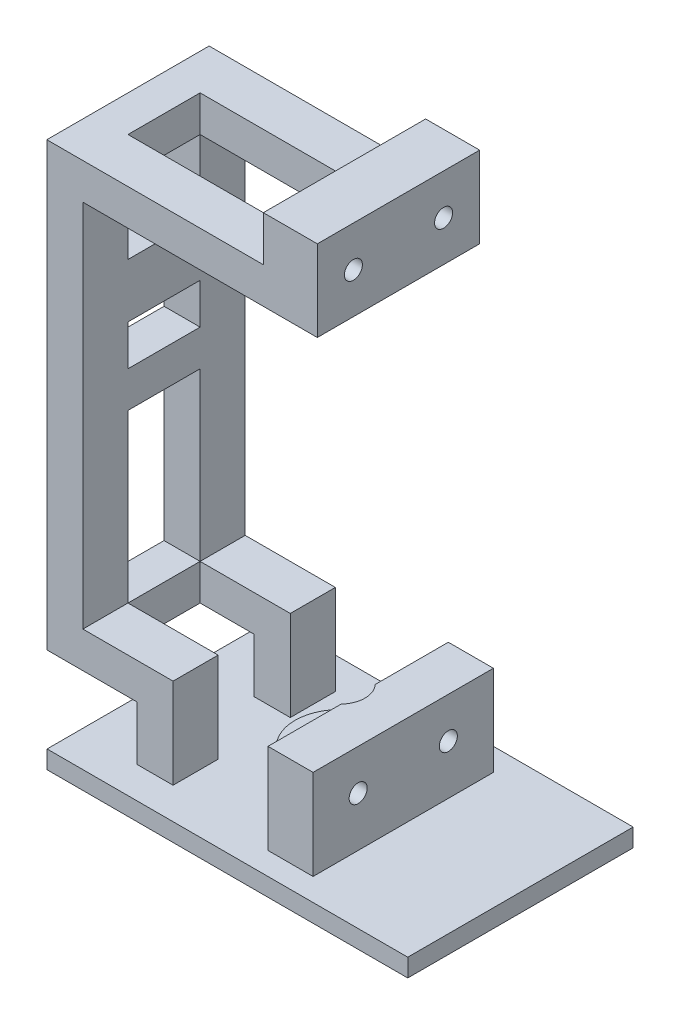
from build123d import *

# Parameters (mm, degrees)
SKETCH1_W                  = 40
SKETCH1_H                  = 25
BOSS_EXTRUDE1_DEPTH        = 2
SKETCH2_W                  = 5
SKETCH2_H                  = 20
BOSS_EXTRUDE2_DEPTH        = 10
SKETCH4_W                  = 19.965035534
SKETCH4_H                  = 6
BOSS_EXTRUDE3_DEPTH        = 5
SKETCH5_R                  = 1
CUT_EXTRUDE2_DEPTH         = 5
SKETCH6_W                  = 4
SKETCH6_H                  = 5
BOSS_EXTRUDE4_DEPTH        = 10
SKETCH8_W                  = 5
SKETCH8_H                  = 4
BOSS_EXTRUDE5_DEPTH        = 10
SKETCH9_W                  = 4
SKETCH9_H                  = 5
BOSS_EXTRUDE6_DEPTH        = 45
SKETCH12_W                 = 18
SKETCH12_H                 = 4
BOSS_EXTRUDE8_DEPTH        = 4
SKETCH13_W                 = 5
SKETCH13_H                 = 4
BOSS_EXTRUDE9_DEPTH        = 26
SKETCH14_W                 = 18
SKETCH14_H                 = 4
BOSS_EXTRUDE10_DEPTH       = 6
SKETCH16_W                 = 5.988277512
SKETCH16_H                 = 18
BOSS_EXTRUDE11_DEPTH       = 5
SKETCH15_R                 = 1
CUT_EXTRUDE3_DEPTH         = 6
SKETCH17_R                 = 3
CUT_EXTRUDE5_DEPTH         = 6
SKETCH24_R                 = 3
BOSS_EXTRUDE18_DEPTH       = 4
SKETCH24_4_R               = 3
BOSS_EXTRUDE19_DEPTH       = 6
BOSS_EXTRUDE20_START       = -1
SKETCH20_R                 = 5
SKETCH20_R_2               = 3
BOSS_EXTRUDE20_DEPTH       = 1
BOSS_EXTRUDE21_OUTLINE_R   = 2.998308623
BOSS_EXTRUDE21_OUTLINE_R_2 = 1.5
BOSS_EXTRUDE21_DEPTH       = 1
SKETCH27_R                 = 5
SKETCH27_R_2               = 2.75
BOSS_EXTRUDE22_DEPTH       = 2
SKETCH28_R                 = 2.75
CUT_EXTRUDE10_DEPTH        = 10


# Read off the part's stored shape, not the designer's step: Boss-Extrude21
with BuildPart() as part:
    # Sketch1 → Boss-Extrude1 (new body)
    with BuildSketch(Plane(origin=(0, 0, 0), x_dir=(1, 0, 0), z_dir=(0, 1, 0))):
        Rectangle(SKETCH1_W, SKETCH1_H)
    extrude(amount=BOSS_EXTRUDE1_DEPTH)

    # Sketch2 → Boss-Extrude2 (add)
    with BuildSketch(Plane(origin=(0, 2, 0), x_dir=(1, 0, 0), z_dir=(0, 1, 0))):
        with Locations((4.5, 0)):
            Rectangle(SKETCH2_W, SKETCH2_H)
    extrude(amount=BOSS_EXTRUDE2_DEPTH)

    # Sketch4 → Boss-Extrude3 (add)
    with BuildSketch(Plane(origin=(7, 0, 0), x_dir=(0, 0, -1), z_dir=(1, 0, 0))):
        with Locations((-0.017482233, 9)):
            Rectangle(SKETCH4_W, SKETCH4_H)
    extrude(amount=-BOSS_EXTRUDE3_DEPTH)

    # Sketch5 → Cut-Extrude2 (cut)
    with BuildSketch(Plane(origin=(7, 0, 0), x_dir=(0, 0, -1), z_dir=(1, 0, 0))):
        with Locations((5, 7.5)):
            Circle(SKETCH5_R)
        with Locations((-5, 7.5)):
            Circle(SKETCH5_R)
    extrude(amount=-CUT_EXTRUDE2_DEPTH, mode=Mode.SUBTRACT)

    # Sketch6 → Boss-Extrude4 (add)
    with BuildSketch(Plane(origin=(0, 2, 0), x_dir=(1, 0, 0), z_dir=(0, 1, 0))):
        with Locations((-11.527661753, -6.5)):
            Rectangle(SKETCH6_W, SKETCH6_H)
        with Locations((-11.527661753, 6.5)):
            Rectangle(SKETCH6_W, SKETCH6_H)
    extrude(amount=BOSS_EXTRUDE4_DEPTH)

    # Sketch8 → Boss-Extrude5 (add)
    with BuildSketch(Plane.ZY.offset(13.527661753)):
        with Locations((-6.5, 10)):
            Rectangle(SKETCH8_W, SKETCH8_H)
    boss_extrude5 = extrude(amount=BOSS_EXTRUDE5_DEPTH)

    # Mirror1: Boss-Extrude5 across plane
    add(boss_extrude5.mirror(Plane(origin=(0, 0, 0), x_dir=(1, 0, 0), z_dir=(0, 0, -1))))

    # Sketch9 → Boss-Extrude6 (add)
    with BuildSketch(Plane(origin=(0, 12, 0), x_dir=(1, 0, 0), z_dir=(0, 1, 0))):
        with Locations((-21.527661753, 6.5)):
            Rectangle(SKETCH9_W, SKETCH9_H)
    boss_extrude6 = extrude(amount=BOSS_EXTRUDE6_DEPTH)

    # Mirror2: Boss-Extrude5 across plane
    add(boss_extrude5.mirror(Plane(origin=(0, 0, 0), x_dir=(1, 0, 0), z_dir=(0, 0, -1))))

    # Mirror3: Boss-Extrude6 across plane
    add(boss_extrude6.mirror(Plane(origin=(0, 0, 0), x_dir=(1, 0, 0), z_dir=(0, 0, -1))))

    # Sketch12 → Boss-Extrude8 (add)
    with BuildSketch(Plane.ZY.offset(23.527661753)):
        with Locations((0, 55)):
            Rectangle(SKETCH12_W, SKETCH12_H)
        with Locations((0, 10)):
            Rectangle(SKETCH12_W, SKETCH12_H)
        with Locations((0, 32.5)):
            Rectangle(SKETCH12_W, SKETCH12_H)
    extrude(amount=-BOSS_EXTRUDE8_DEPTH)

    # Sketch13 → Boss-Extrude9 (add)
    with BuildSketch(Plane(origin=(-19.527661753, 0, 0), x_dir=(0, 0, -1), z_dir=(1, 0, 0))):
        with Locations((-6.5, 55)):
            Rectangle(SKETCH13_W, SKETCH13_H)
        with Locations((6.5, 55)):
            Rectangle(SKETCH13_W, SKETCH13_H)
    extrude(amount=BOSS_EXTRUDE9_DEPTH)

    # Sketch14 → Boss-Extrude10 (add)
    with BuildSketch(Plane(origin=(6.472338247, 0, 0), x_dir=(0, 0, -1), z_dir=(1, 0, 0))):
        with Locations((0, 55)):
            Rectangle(SKETCH14_W, SKETCH14_H)
    extrude(amount=-BOSS_EXTRUDE10_DEPTH)

    # Sketch16 → Boss-Extrude11 (add)
    with BuildSketch(Plane(origin=(0, 57, 0), x_dir=(1, 0, 0), z_dir=(0, 1, 0))):
        with Locations((3.478199491, 0)):
            Rectangle(SKETCH16_W, SKETCH16_H)
    extrude(amount=BOSS_EXTRUDE11_DEPTH)

    # Sketch15 → Cut-Extrude3 (cut)
    with BuildSketch(Plane(origin=(6.472338247, 0, 0), x_dir=(0, 0, -1), z_dir=(1, 0, 0))):
        with Locations((-5, 57.5)):
            Circle(SKETCH15_R)
        with Locations((5, 57.5)):
            Circle(SKETCH15_R)
    extrude(amount=-CUT_EXTRUDE3_DEPTH, mode=Mode.SUBTRACT)

    # Sketch17 → Cut-Extrude5 (cut)
    with BuildSketch(Plane.XZ):
        with Locations(Location((0, 0, 0), (0, 0, 270))):
            Circle(SKETCH17_R)
    extrude(amount=-CUT_EXTRUDE5_DEPTH, mode=Mode.SUBTRACT)

    # Sketch24 → Boss-Extrude18 (add)
    with BuildSketch(Plane.ZY.offset(23.527661753)):
        with Locations((0, 42)):
            Circle(SKETCH24_R)
        with BuildLine():
            Line((-4, 45), (-4, 39))
            Line((-4, 39), (0, 39))
            ThreePointArc((0, 39), (-3, 42.000000012), (2.4e-08, 45))
            Line((2.4e-08, 45), (-4, 45))
        make_face()
        with BuildLine():
            ThreePointArc((3, 42), (2.121320344, 39.878679656), (0, 39))
            Line((0, 39), (4, 39))
            Line((4, 39), (4, 45))
            Line((4, 45), (2.4e-08, 45))
            ThreePointArc((2.4e-08, 45), (2.121320352, 44.121320335), (3, 42))
        make_face()
    extrude(amount=-BOSS_EXTRUDE18_DEPTH)

    # Sketch24<4> → Boss-Extrude19 (add)
    with BuildSketch(Plane.ZY.offset(23.527661753)):
        with Locations(Location((0, 42, 0), (0, 0, 270))):
            Circle(SKETCH24_4_R)
    extrude(amount=BOSS_EXTRUDE19_DEPTH)

    # Sketch20 → Boss-Extrude20 (add)
    with BuildSketch(Plane(origin=(0, 3, 0), x_dir=(1, 0, 0), z_dir=(0, 1, 0)).offset(BOSS_EXTRUDE20_START)):
        Circle(SKETCH20_R)
        with Locations(Location((0, 0, 0), (0, 0, 90))):
            Circle(SKETCH20_R_2, mode=Mode.SUBTRACT)
    extrude(amount=BOSS_EXTRUDE20_DEPTH)

    # Boss-Extrude21 outline → Boss-Extrude21 (add)
    # profile 1 of 2: a face of its own
    with BuildSketch(Plane(origin=(0, 3, 0), x_dir=(1, 0, 0), z_dir=(0, 1, 0))):
        with BuildLine():
            ThreePointArc((2, -2.236067977), (-3, 0), (2, 2.236067977))
            Line((2, 2.236067977), (2, 4.582575695))
            ThreePointArc((2, 4.582575695), (-5, 0), (2, -4.582575695))
            Line((2, -4.582575695), (2, -2.236067977))
        make_face()
    # profile 2 of 2: a face of its own
    with BuildSketch(Plane(origin=(0, 3, 0), x_dir=(1, 0, 0), z_dir=(0, 1, 0))):
        Circle(BOSS_EXTRUDE21_OUTLINE_R)
        Circle(BOSS_EXTRUDE21_OUTLINE_R_2, mode=Mode.SUBTRACT)
    extrude(amount=BOSS_EXTRUDE21_DEPTH)

    # Sketch27 → Boss-Extrude22 (add)
    with BuildSketch(Plane(origin=(0, 4, 0), x_dir=(1, 0, 0), z_dir=(0, 1, 0))):
        Circle(SKETCH27_R)
        with Locations(Location((0, 0, 0), (0, 0, 43.341758227))):
            Circle(SKETCH27_R_2, mode=Mode.SUBTRACT)
    extrude(amount=BOSS_EXTRUDE22_DEPTH)

    # Sketch28 → Cut-Extrude10 (cut)
    with BuildSketch(Plane(origin=(0, 6, 0), x_dir=(1, 0, 0), z_dir=(0, 1, 0))):
        with Locations(Location((0, 0, 0), (0, 0, 43.341758227))):
            Circle(SKETCH28_R)
    extrude(amount=CUT_EXTRUDE10_DEPTH, mode=Mode.SUBTRACT)


solid = part.part
